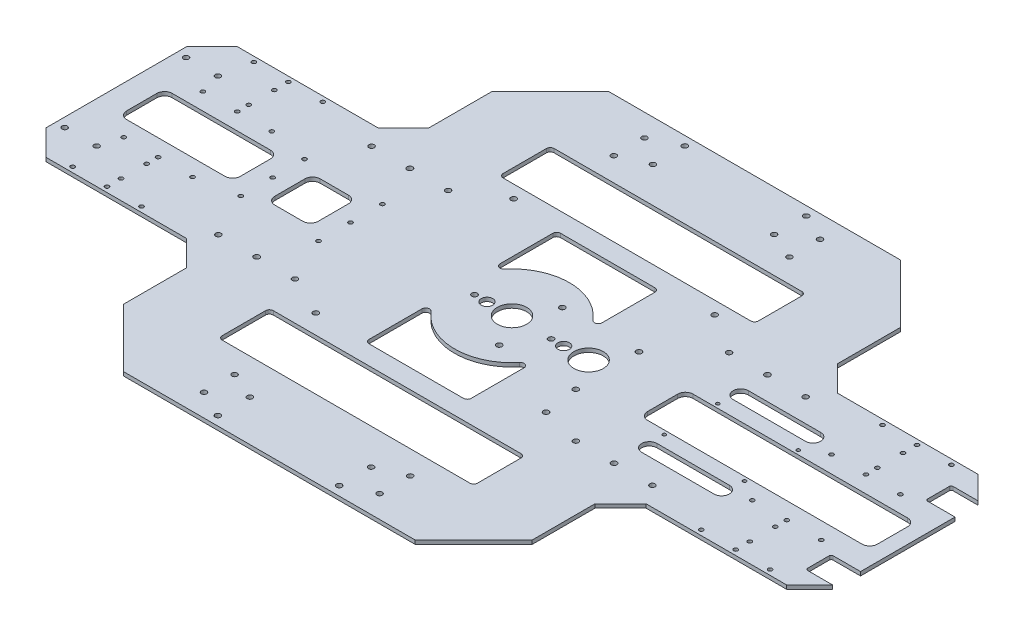
from build123d import *

# Parameters (mm, degrees)
EXTRUDE_1_DEPTH      = 3
CHAMFER_1_SIZE       = 20
SKETCH_2_W           = 320
SKETCH_2_H           = 20
CUT_EXTRUDE_1_DEPTH  = 5
CHAMFER_2_SIZE       = 50
SKETCH_3_R           = 2.1
SKETCH_3_R_2         = 2.099999999
SKETCH_3_R_3         = 2.100000001
CUT_EXTRUDE_2_DEPTH  = 80
SKETCH_4_R           = 2.15
CUT_EXTRUDE_3_DEPTH  = 10
SKETCH_5_R           = 1.6
SKETCH_5_R_2         = 2.1
SKETCH_5_R_3         = 2.2
CUT_EXTRUDE_4_DEPTH  = 29
EXTRUDE_2_DEPTH      = 3
SKETCH_7_W           = 23
SKETCH_7_H           = 20
CUT_EXTRUDE_5_DEPTH  = 3
FILLET_1_R           = 1.5
SKETCH_9_R           = 2.15
CUT_EXTRUDE_6_DEPTH  = 3
SKETCH_10_R          = 11.5
SKETCH_10_R_2        = 4.5
SKETCH_10_R_3        = 2.15
CUT_EXTRUDE_7_DEPTH  = 5
SKETCH_11_R          = 1.6
CUT_EXTRUDE_8_DEPTH  = 10
SKETCH_13_R          = 1.35
CUT_EXTRUDE_9_DEPTH  = 3
CUT_EXTRUDE_10_DEPTH = 3
CUT_EXTRUDE_START    = -3
SKETCH_15_R          = 2.15
SKETCH_15_R_2        = 4.5
SKETCH_15_R_3        = 11.5
CUT_EXTRUDE_11_DEPTH = 3
CUT_EXTRUDE_12_DEPTH = 3
CUT_EXTRUDE_13_DEPTH = 3


with BuildPart() as part:
    # 草图1 → 凸台-拉伸1 (new body)
    with BuildSketch(Plane(origin=(0, 0, 0), x_dir=(1, 0, 0), z_dir=(0, 1, 0))):
        Polygon((-310, -75), (-160, -75), (-160, -200), (160, -200), (160, -75), (310, -75), (310, 75), (160, 75), (160, 200), (-160, 200), (-160, 75), (-310, 75), align=None)
    extrude(amount=EXTRUDE_1_DEPTH)

    # 倒角1
    chamfer_1_edges = [part.edges().sort_by_distance(p)[0] for p in [
        (-160, 1.5, -75),
        (-310, 1.5, -75),
        (-310, 1.5, 75),
        (-160, 1.5, 75),
        (160, 1.5, 75),
        (160, 1.5, -75),
        (310, 1.5, 75),
        (310, 1.5, -75),
    ]]
    chamfer(chamfer_1_edges, length=CHAMFER_1_SIZE)

    # 草图2 → 切除-拉伸1 (cut)
    with BuildSketch(Plane(origin=(0, 3, 0), x_dir=(1, 0, 0), z_dir=(0, 1, 0))):
        with Locations((0, 190)):
            Rectangle(SKETCH_2_W, SKETCH_2_H)
        with Locations((0, -190)):
            Rectangle(SKETCH_2_W, SKETCH_2_H)
    extrude(amount=-CUT_EXTRUDE_1_DEPTH, mode=Mode.SUBTRACT)

    # 倒角2
    chamfer_2_edges = [part.edges().sort_by_distance(p)[0] for p in [
        (-160, 1.5, -180),
        (-160, 1.5, 180),
        (160, 1.5, -180),
        (160, 1.5, 180),
    ]]
    chamfer(chamfer_2_edges, length=CHAMFER_2_SIZE)

    # 草图3 → 切除-拉伸2 (cut)
    with BuildSketch(Plane(origin=(0, 3, 0), x_dir=(1, 0, 0), z_dir=(0, 1, 0))):
        with Locations((-302.826293853, 47.5)):
            Circle(SKETCH_3_R)
        with Locations((-277.826293853, 47.5)):
            Circle(SKETCH_3_R)
        with Locations((-47.5, 182.826293853)):
            Circle(SKETCH_3_R)
        with Locations((-47.5, 157.826293853)):
            Circle(SKETCH_3_R)
        with Locations((47.5, 182.826293853)):
            Circle(SKETCH_3_R)
        with Locations((47.5, 157.826293853)):
            Circle(SKETCH_3_R)
        with Locations((302.700177837, 47.5)):
            Circle(SKETCH_3_R_2)
        with Locations((327.700177837, 47.5)):
            Circle(SKETCH_3_R_2)
        with Locations((-68.75, 172.5)):
            Circle(SKETCH_3_R)
        with Locations((-68.75, 148.5)):
            Circle(SKETCH_3_R)
        with Locations((68.75, 172.5)):
            Circle(SKETCH_3_R)
        with Locations((68.75, 148.5)):
            Circle(SKETCH_3_R)
        with Locations((68.75, -148.5)):
            Circle(SKETCH_3_R)
        with Locations((68.75, -172.5)):
            Circle(SKETCH_3_R)
        with Locations((-68.75, -148.5)):
            Circle(SKETCH_3_R)
        with Locations((-68.75, -172.5)):
            Circle(SKETCH_3_R)
        with Locations((327.700177837, -47.5)):
            Circle(SKETCH_3_R_3)
        with Locations((302.700177837, -47.5)):
            Circle(SKETCH_3_R_3)
        with Locations((47.5, -157.826293853)):
            Circle(SKETCH_3_R)
        with Locations((47.5, -182.826293853)):
            Circle(SKETCH_3_R)
        with Locations((-47.5, -157.826293853)):
            Circle(SKETCH_3_R)
        with Locations((-47.5, -182.826293853)):
            Circle(SKETCH_3_R)
        with Locations((-277.826293853, -47.5)):
            Circle(SKETCH_3_R)
        with Locations((-302.826293853, -47.5)):
            Circle(SKETCH_3_R)
    extrude(amount=-CUT_EXTRUDE_2_DEPTH, mode=Mode.SUBTRACT)

    # 草图4 → 切除-拉伸3 (cut)
    with BuildSketch(Plane.XZ):
        with Locations((-78.739999994, 74.909999989)):
            Circle(SKETCH_4_R)
        with Locations((-78.739999994, -80.01)):
            Circle(SKETCH_4_R)
        with Locations((78.740000006, -80.01)):
            Circle(SKETCH_4_R)
        with Locations((78.740000006, 52.07)):
            Circle(SKETCH_4_R)
    extrude(amount=-CUT_EXTRUDE_3_DEPTH, mode=Mode.SUBTRACT)

    # 草图5 → 切除-拉伸4 (cut)
    with BuildSketch(Plane(origin=(0, 3, 0), x_dir=(1, 0, 0), z_dir=(0, 1, 0))):
        with Locations((219.200177837, 71)):
            Circle(SKETCH_5_R)
        with Locations((273.200177837, 71)):
            Circle(SKETCH_5_R)
        with Locations((246.200177837, 71)):
            Circle(SKETCH_5_R)
        with Locations((219.200177837, 30.998400192)):
            Circle(SKETCH_5_R)
        with Locations((246.200177837, 30.998400192)):
            Circle(SKETCH_5_R)
        with Locations((273.200177837, 30.998400192)):
            Circle(SKETCH_5_R)
        with Locations((246.200177837, 60)):
            Circle(SKETCH_5_R)
        with Locations((246.200177837, 40)):
            Circle(SKETCH_5_R)
        with Locations((246.200177837, -40)):
            Circle(SKETCH_5_R)
        with Locations((246.200177837, -60)):
            Circle(SKETCH_5_R)
        with Locations((273.200177837, -30.998400192)):
            Circle(SKETCH_5_R)
        with Locations((246.200177837, -30.998400192)):
            Circle(SKETCH_5_R)
        with Locations((219.200177837, -30.998400192)):
            Circle(SKETCH_5_R)
        with Locations((246.200177837, -71)):
            Circle(SKETCH_5_R)
        with Locations((273.200177837, -71)):
            Circle(SKETCH_5_R)
        with Locations((219.200177837, -71)):
            Circle(SKETCH_5_R)
        with Locations((-219.200177837, -71)):
            Circle(SKETCH_5_R)
        with Locations((-273.200177837, -71)):
            Circle(SKETCH_5_R)
        with Locations((-246.200177837, -71)):
            Circle(SKETCH_5_R)
        with Locations((-219.200177837, -30.998400192)):
            Circle(SKETCH_5_R)
        with Locations((-246.200177837, -30.998400192)):
            Circle(SKETCH_5_R)
        with Locations((-273.200177837, -30.998400192)):
            Circle(SKETCH_5_R)
        with Locations((-246.200177837, -60)):
            Circle(SKETCH_5_R)
        with Locations((-246.200177837, -40)):
            Circle(SKETCH_5_R)
        with Locations((-246.200177837, 40)):
            Circle(SKETCH_5_R)
        with Locations((-246.200177837, 60)):
            Circle(SKETCH_5_R)
        with Locations((-273.200177837, 30.998400192)):
            Circle(SKETCH_5_R)
        with Locations((-246.200177837, 30.998400192)):
            Circle(SKETCH_5_R)
        with Locations((-219.200177837, 30.998400192)):
            Circle(SKETCH_5_R)
        with Locations((-246.200177837, 71)):
            Circle(SKETCH_5_R)
        with Locations((-273.200177837, 71)):
            Circle(SKETCH_5_R)
        with Locations((-219.200177837, 71)):
            Circle(SKETCH_5_R)
        with Locations((170, -60)):
            Circle(SKETCH_5_R_2)
        with Locations((110, -60)):
            Circle(SKETCH_5_R_2)
        with Locations((140, -60)):
            Circle(SKETCH_5_R_3)
        with Locations((140, 60)):
            Circle(SKETCH_5_R_3)
        with Locations((110, 60)):
            Circle(SKETCH_5_R_2)
        with Locations((170, 60)):
            Circle(SKETCH_5_R_2)
        with Locations((-170, 60)):
            Circle(SKETCH_5_R_2)
        with Locations((-110, 60)):
            Circle(SKETCH_5_R_2)
        with Locations((-140, 60)):
            Circle(SKETCH_5_R_3)
        with Locations((-140, -60)):
            Circle(SKETCH_5_R_3)
        with Locations((-110, -60)):
            Circle(SKETCH_5_R_2)
        with Locations((-170, -60)):
            Circle(SKETCH_5_R_2)
    extrude(amount=-CUT_EXTRUDE_4_DEPTH, mode=Mode.SUBTRACT)

    # 草图6 → 凸台-拉伸2 (add)
    with BuildSketch(Plane(origin=(0, 3, 0), x_dir=(1, 0, 0), z_dir=(0, 1, 0))):
        Polygon((-160, 144.142135624), (-160, 130), (-110, 180), (110, 180), (160, 130), (160, 144.142135624), (114.142135624, 190), (-114.142135624, 190), align=None)
        Polygon((114.142135624, -190), (160, -144.142135624), (160, -130), (110, -180), (-110, -180), (-160, -130), (-160, -144.142135624), (-114.142135624, -190), align=None)
    extrude(amount=-EXTRUDE_2_DEPTH)

    # 草图7 → 切除-拉伸5 (cut)
    with BuildSketch(Plane(origin=(0, 3, 0), x_dir=(1, 0, 0), z_dir=(0, 1, 0))):
        with Locations((298.5, 47)):
            Rectangle(SKETCH_7_W, SKETCH_7_H)
        with Locations((298.5, -47)):
            Rectangle(SKETCH_7_W, SKETCH_7_H)
    extrude(amount=-CUT_EXTRUDE_5_DEPTH, mode=Mode.SUBTRACT)

    # 圆角1
    fillet_1_edges = [part.edges().sort_by_distance(p)[0] for p in [
        (287, 1.5, 37),
        (287, 1.5, 57),
        (287, 1.5, -37),
        (287, 1.5, -57),
    ]]
    fillet(fillet_1_edges, radius=FILLET_1_R)

    # 草图9 → 切除-拉伸6 (cut)
    with BuildSketch(Plane.XZ):
        with Locations((-47.5, 182.87842708)):
            Circle(SKETCH_9_R)
        with Locations((47.5, 182.87842708)):
            Circle(SKETCH_9_R)
        with Locations((47.5, -182.87842708)):
            Circle(SKETCH_9_R)
        with Locations((-47.5, -182.87842708)):
            Circle(SKETCH_9_R)
    extrude(amount=-CUT_EXTRUDE_6_DEPTH, mode=Mode.SUBTRACT)

    # 草图10 → 切除-拉伸7 (cut)
    with BuildSketch(Plane.XZ):
        with Locations((60, 0)):
            Circle(SKETCH_10_R)
        with Locations((40.751891048, 0.269818043)):
            Circle(SKETCH_10_R_2)
        with Locations((74.146554322, -25.315509097)):
            Circle(SKETCH_10_R_3)
        with Locations((74.850596826, 24.909029967)):
            Circle(SKETCH_10_R_3)
        with Locations((31.002848852, 0.406479129)):
            Circle(SKETCH_10_R_3)
    extrude(amount=-CUT_EXTRUDE_7_DEPTH, mode=Mode.SUBTRACT)

    # 草图11 → 切除-拉伸8 (cut)
    with BuildSketch(Plane.XZ):
        with Locations((-126.5, -25)):
            Circle(SKETCH_11_R)
        with Locations((-187.5, -25)):
            Circle(SKETCH_11_R)
        with Locations((-126.5, 0)):
            Circle(SKETCH_11_R)
        with Locations((-187.5, 0)):
            Circle(SKETCH_11_R)
        with Locations((-187.5, 25)):
            Circle(SKETCH_11_R)
        with Locations((-126.5, 25)):
            Circle(SKETCH_11_R)
    extrude(amount=-CUT_EXTRUDE_8_DEPTH, mode=Mode.SUBTRACT)

    # 草图13 → 切除-拉伸9 (cut)
    with BuildSketch(Plane(origin=(0, 3, 0), x_dir=(1, 0, 0), z_dir=(0, 1, 0))):
        with Locations((140.200177837, 21)):
            Circle(SKETCH_13_R)
        with Locations((203.200177837, 21)):
            Circle(SKETCH_13_R)
        with Locations((203.200177837, -21)):
            Circle(SKETCH_13_R)
        with Locations((140.200177837, -21)):
            Circle(SKETCH_13_R)
        with BuildLine():
            Line((143.400177837, 41.8), (200.000177837, 41.8))
            ThreePointArc((200.000177837, 41.8), (206.000177837, 35.8), (200.000177837, 29.8))
            Line((200.000177837, 29.8), (143.400177837, 29.8))
            ThreePointArc((143.400177837, 29.8), (137.400177837, 35.8), (143.400177837, 41.8))
        make_face()
        with BuildLine():
            Line((143.400177837, -29.8), (200.000177837, -29.8))
            ThreePointArc((200.000177837, -29.8), (206.000177837, -35.8), (200.000177837, -41.8))
            Line((200.000177837, -41.8), (143.400177837, -41.8))
            ThreePointArc((143.400177837, -41.8), (137.400177837, -35.8), (143.400177837, -29.8))
        make_face()
    extrude(amount=-CUT_EXTRUDE_9_DEPTH, mode=Mode.SUBTRACT)

    # 草图14 → 切除-拉伸10 (cut)
    with BuildSketch(Plane(origin=(0, 3, 0), x_dir=(1, 0, 0), z_dir=(0, 1, 0))):
        with BuildLine():
            Line((292, 17.8), (124, 17.8))
            ThreePointArc((124, 17.8), (119.757359313, 16.042640687), (118, 11.8))
            Line((118, 11.8), (118, -11.8))
            ThreePointArc((118, -11.8), (119.757359313, -16.042640687), (124, -17.8))
            Line((124, -17.8), (292, -17.8))
            ThreePointArc((292, -17.8), (296.242640687, -16.042640687), (298, -11.8))
            Line((298, -11.8), (298, 11.8))
            ThreePointArc((298, 11.8), (296.242640687, 16.042640687), (292, 17.8))
        make_face()
    extrude(amount=-CUT_EXTRUDE_10_DEPTH, mode=Mode.SUBTRACT)

    # 草图15 → 切除-拉伸11 (cut)
    with BuildSketch(Plane(origin=(0, 3, 0), x_dir=(1, 0, 0), z_dir=(0, 1, 0)).offset(CUT_EXTRUDE_START)):
        with Locations((74.850596826, -24.909029967)):
            Circle(SKETCH_15_R)
        with Locations((74.146554322, 25.315509097)):
            Circle(SKETCH_15_R)
        with Locations((31.002848852, -0.406479129)):
            Circle(SKETCH_15_R)
        with Locations((40.751891048, -0.269818043)):
            Circle(SKETCH_15_R_2)
        with Locations((60, 0)):
            Circle(SKETCH_15_R_3)
        with Locations((14.850596826, -24.909029967)):
            Circle(SKETCH_15_R)
        with Locations((14.146554322, 25.315509097)):
            Circle(SKETCH_15_R)
        with Locations((-28.997151148, -0.34594168)):
            Circle(SKETCH_15_R)
        with Locations((-19.248108952, -0.335301641)):
            Circle(SKETCH_15_R_2)
        Circle(SKETCH_15_R_3)
    extrude(amount=CUT_EXTRUDE_11_DEPTH, mode=Mode.SUBTRACT)

    # 草图16 → 切除-拉伸12 (cut)
    with BuildSketch(Plane(origin=(0, 3, 0), x_dir=(1, 0, 0), z_dir=(0, 1, 0))):
        with BuildLine():
            Line((97, 130), (-97, 130))
            ThreePointArc((-97, 130), (-99.121320344, 129.121320344), (-100, 127))
            Line((-100, 127), (-100, 93))
            ThreePointArc((-100, 93), (-99.121320344, 90.878679656), (-97, 90))
            Line((-97, 90), (97, 90))
            ThreePointArc((97, 90), (99.121320344, 90.878679656), (100, 93))
            Line((100, 93), (100, 127))
            ThreePointArc((100, 127), (99.121320344, 129.121320344), (97, 130))
        make_face()
        with BuildLine():
            Line((97, -90), (-97, -90))
            ThreePointArc((-97, -90), (-99.121320344, -90.878679656), (-100, -93))
            Line((-100, -93), (-100, -127))
            ThreePointArc((-100, -127), (-99.121320344, -129.121320344), (-97, -130))
            Line((-97, -130), (97, -130))
            ThreePointArc((97, -130), (99.121320344, -129.121320344), (100, -127))
            Line((100, -127), (100, -93))
            ThreePointArc((100, -93), (99.121320344, -90.878679656), (97, -90))
        make_face()
        with BuildLine():
            ThreePointArc((-37, 75), (-39.121320344, 74.121320344), (-40, 72))
            Line((-40, 72), (-40, 30.577769703))
            ThreePointArc((-40, 30.577769703), (-38.015504801, 27.754872255), (-34.6875, 28.666659096))
            ThreePointArc((-34.6875, 28.666659096), (0, 45), (34.6875, 28.666659096))
            ThreePointArc((34.6875, 28.666659096), (38.015504801, 27.754872255), (40, 30.577769703))
            Line((40, 30.577769703), (40, 72))
            ThreePointArc((40, 72), (39.121320344, 74.121320344), (37, 75))
            Line((37, 75), (-37, 75))
        make_face()
        with BuildLine():
            ThreePointArc((-34.6875, -28.666659096), (-38.015504801, -27.754872255), (-40, -30.577769703))
            Line((-40, -30.577769703), (-40, -72))
            ThreePointArc((-40, -72), (-39.121320344, -74.121320344), (-37, -75))
            Line((-37, -75), (37, -75))
            ThreePointArc((37, -75), (39.121320344, -74.121320344), (40, -72))
            Line((40, -72), (40, -30.577769703))
            ThreePointArc((40, -30.577769703), (38.015504801, -27.754872255), (34.6875, -28.666659096))
            ThreePointArc((34.6875, -28.666659096), (0, -45), (-34.6875, -28.666659096))
        make_face()
    extrude(amount=-CUT_EXTRUDE_12_DEPTH, mode=Mode.SUBTRACT)

    # 草图17 → 切除-拉伸13 (cut)
    with BuildSketch(Plane(origin=(0, 3, 0), x_dir=(1, 0, 0), z_dir=(0, 1, 0))):
        with BuildLine():
            Line((-283.954023474, 17.8), (-207, 17.8))
            ThreePointArc((-207, 17.8), (-202.757359313, 16.042640687), (-201, 11.8))
            Line((-201, 11.8), (-201, -11.8))
            ThreePointArc((-201, -11.8), (-202.757359313, -16.042640687), (-207, -17.8))
            Line((-207, -17.8), (-283.954023474, -17.8))
            ThreePointArc((-283.954023474, -17.8), (-288.196664161, -16.042640687), (-289.954023474, -11.8))
            Line((-289.954023474, -11.8), (-289.954023474, 11.8))
            ThreePointArc((-289.954023474, 11.8), (-288.196664161, 16.042640687), (-283.954023474, 17.8))
        make_face()
        with BuildLine():
            Line((-168, 17.8), (-146, 17.8))
            ThreePointArc((-146, 17.8), (-141.757359313, 16.042640687), (-140, 11.8))
            Line((-140, 11.8), (-140, -11.8))
            ThreePointArc((-140, -11.8), (-141.757359313, -16.042640687), (-146, -17.8))
            Line((-146, -17.8), (-168, -17.8))
            ThreePointArc((-168, -17.8), (-172.242640687, -16.042640687), (-174, -11.8))
            Line((-174, -11.8), (-174, 11.8))
            ThreePointArc((-174, 11.8), (-172.242640687, 16.042640687), (-168, 17.8))
        make_face()
    extrude(amount=-CUT_EXTRUDE_13_DEPTH, mode=Mode.SUBTRACT)


solid = part.part
